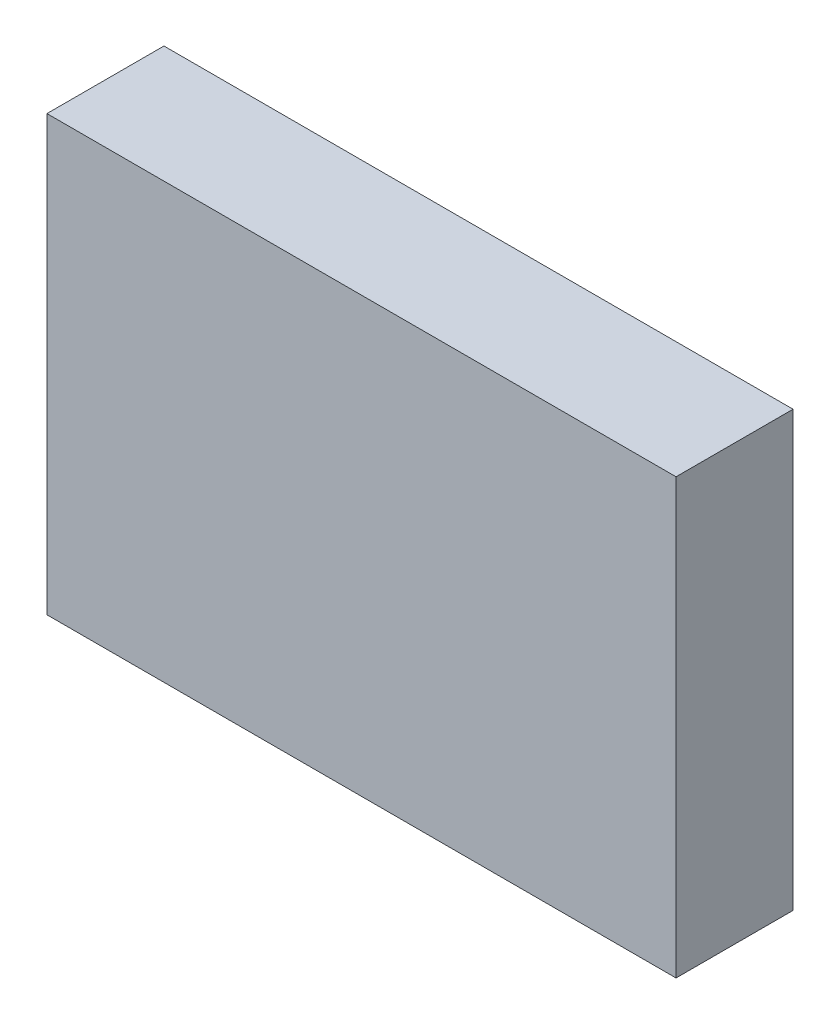
from build123d import *

# Parameters (mm, degrees)
SKETCH1_W           = 80
SKETCH1_H           = 14.88
BOSS_EXTRUDE1_DEPTH = 55.2


with BuildPart() as part:
    # Sketch1 → Boss-Extrude1 (new body)
    with BuildSketch(Plane(origin=(0, 0, 0), x_dir=(1, 0, 0), z_dir=(0, 1, 0))):
        Rectangle(SKETCH1_W, SKETCH1_H)
    extrude(amount=-BOSS_EXTRUDE1_DEPTH)


solid = part.part
